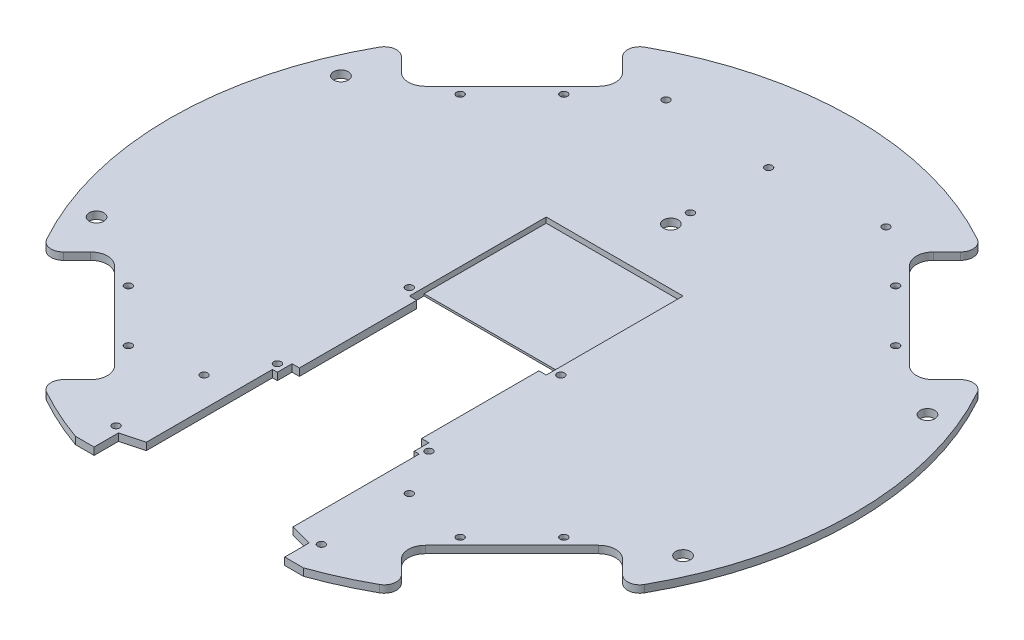
from build123d import *

# Parameters (mm, degrees)
SKETCH1_R                = 140
BOSS_EXTRUDE1_DEPTH      = 3
CUT_EXTRUDE4_REACH       = 200.013
CUT_EXTRUDE6_REACH       = 200.013
SKETCH9_R                = 1.5
FILLET1_R                = 5
CIRPATTERN1_COUNT        = 4
FILLET1_OF_CIRPATTERN1_R = 5
CUT_EXTRUDE1_REACH       = 200.013
FILLET3_R                = 1.5
CUT_EXTRUDE7_REACH       = 200.013
SKETCH10_R               = 1.5
CUT_EXTRUDE9_REACH       = 200.013
SKETCH13_R               = 1.5
CUT_EXTRUDE12_REACH      = 200.013
SKETCH16_R               = 1.5
SKETCH16_R_2             = 3
CUT_EXTRUDE13_REACH      = 200.013
SKETCH17_R               = 3
SKETCH18_W               = 56
SKETCH18_H               = 50
CUT_EXTRUDE14_DEPTH      = 2.2


with BuildPart() as part:
    # Sketch1 → Boss-Extrude1 (new body)
    with BuildSketch(Plane(origin=(0, 0, 0), x_dir=(1, 0, 0), z_dir=(0, 1, 0))):
        Circle(SKETCH1_R)
    extrude(amount=BOSS_EXTRUDE1_DEPTH)

    # Sketch7 → Cut-Extrude4 (cut, up to next)
    with BuildSketch(Plane(origin=(0, 3, 0), x_dir=(1, 0, 0), z_dir=(0, 1, 0)), mode=Mode.PRIVATE) as cut_extrude4_sk1:
        with BuildLine():
            Line((-99.030304705, -63.604254968), (-63.604254968, -99.030304705))
            ThreePointArc((-63.604254968, -99.030304705), (-61.568647097, -103.944696834), (-63.604254968, -108.859088964))
            Line((-63.604254968, -108.859088964), (-76.367532368, -121.622366364))
            Line((-76.367532368, -121.622366364), (-121.622366364, -76.367532368))
            Line((-121.622366364, -76.367532368), (-108.859088964, -63.604254968))
            ThreePointArc((-108.859088964, -63.604254968), (-103.944696834, -61.568647097), (-99.030304705, -63.604254968))
        make_face()
    cut_extrude4_tool1 = extrude(cut_extrude4_sk1.sketch, amount=-CUT_EXTRUDE4_REACH, mode=Mode.PRIVATE) & part.part
    cut_extrude4 = cut_extrude4_tool1.solids().sort_by_distance((-90.257735, 3, 90.257735))[0]
    add(cut_extrude4, mode=Mode.SUBTRACT)

    # Sketch9 → Cut-Extrude6 (cut, up to next)
    with BuildSketch(Plane(origin=(0, 3, 0), x_dir=(1, 0, 0), z_dir=(0, 1, 0)), mode=Mode.PRIVATE) as cut_extrude6_sk1:
        with Locations((-89.09545443, -67.882250994)):
            Circle(SKETCH9_R)
    cut_extrude6_tool1 = extrude(cut_extrude6_sk1.sketch, amount=-CUT_EXTRUDE6_REACH, mode=Mode.PRIVATE) & part.part
    # Sketch9 → Cut-Extrude6 (cut, up to next)
    with BuildSketch(Plane(origin=(0, 3, 0), x_dir=(1, 0, 0), z_dir=(0, 1, 0)), mode=Mode.PRIVATE) as cut_extrude6_sk2:
        with Locations((-67.882250994, -89.09545443)):
            Circle(SKETCH9_R)
    cut_extrude6_tool2 = extrude(cut_extrude6_sk2.sketch, amount=-CUT_EXTRUDE6_REACH, mode=Mode.PRIVATE) & part.part
    cut_extrude6_1 = cut_extrude6_tool1.solids().sort_by_distance((-89.095454, 3, 67.882251))[0]
    add(cut_extrude6_1, mode=Mode.SUBTRACT)
    cut_extrude6_2 = cut_extrude6_tool2.solids().sort_by_distance((-67.882251, 3, 89.095454))[0]
    add(cut_extrude6_2, mode=Mode.SUBTRACT)
    cut_extrude6 = cut_extrude6_1 + cut_extrude6_2  # Cut-Extrude6 as one shape, for the pattern or mirror that repeats it

    # Fillet1
    fillet1_edges = [part.edges().sort_by_distance(p)[0] for p in [
        (-73.746853427, 1.5, 119.001687423),
        (-119.001687423, 1.5, 73.746853427),
    ]]
    fillet(fillet1_edges, radius=FILLET1_R)

    # CirPattern1: Cut-Extrude4, Cut-Extrude6 ×4 about axis
    cirpattern1_axis = Axis((0, 3, 0), (0, 1, 0))
    add([cut_extrude4.rotate(cirpattern1_axis, i * 360 / CIRPATTERN1_COUNT) for i in range(1, CIRPATTERN1_COUNT)], mode=Mode.SUBTRACT)
    add([cut_extrude6.rotate(cirpattern1_axis, i * 360 / CIRPATTERN1_COUNT) for i in range(1, CIRPATTERN1_COUNT)], mode=Mode.SUBTRACT)

    # Fillet1 of CirPattern1
    fillet1_of_cirpattern1_edges = [part.edges().sort_by_distance(p)[0] for p in [
        (119.001687423, 1.5, 73.746853427),
        (73.746853427, 1.5, 119.001687423),
        (73.746853427, 1.5, -119.001687423),
        (119.001687423, 1.5, -73.746853427),
        (-119.001687423, 1.5, -73.746853427),
        (-73.746853427, 1.5, -119.001687423),
    ]]
    fillet(fillet1_of_cirpattern1_edges, radius=FILLET1_OF_CIRPATTERN1_R)

    # Sketch2 → Cut-Extrude1 (cut, up to next)
    with BuildSketch(Plane(origin=(0, 3, 0), x_dir=(1, 0, 0), z_dir=(0, 1, 0)), mode=Mode.PRIVATE) as cut_extrude1_sk1:
        Polygon((-46.647615159, -132), (-39, -132), (-39, -122), (-30, -119.588457268), (-30, -68), (-28, -68), (-28, -62), (-25, -62), (-25, -14), (-28, -14), (-28, -8), (28, -8), (28, -14), (25, -14), (25, -62), (28, -62), (28, -68), (30, -68), (30, -119.588457268), (39, -122), (39, -132), (46.647615159, -132), (46.647615159, -140), (-46.647615159, -140), align=None)
    cut_extrude1_tool1 = extrude(cut_extrude1_sk1.sketch, amount=-CUT_EXTRUDE1_REACH, mode=Mode.PRIVATE) & part.part
    add(cut_extrude1_tool1.solids().sort_by_distance((0, 3, 79.863408))[0], mode=Mode.SUBTRACT)

    # Fillet3
    fillet3_edges = [part.edges().sort_by_distance(p)[0] for p in [
        (67.882250994, 0, 90.59545443),
        (89.09545443, 0, 69.382250994),
        (90.59545443, 0, -67.882250994),
        (69.382250994, 0, -89.09545443),
        (-67.882250994, 0, -90.59545443),
        (-89.09545443, 0, -69.382250994),
        (-69.382250994, 0, 89.09545443),
        (-90.59545443, 0, 67.882250994),
    ]]
    fillet(fillet3_edges, radius=FILLET3_R)

    # Sketch10 → Cut-Extrude7 (cut, up to next)
    with BuildSketch(Plane(origin=(0, 3, 0), x_dir=(1, 0, 0), z_dir=(0, 1, 0)), mode=Mode.PRIVATE) as cut_extrude7_sk1:
        with Locations((-31, -65)):
            Circle(SKETCH10_R)
    cut_extrude7_tool1 = extrude(cut_extrude7_sk1.sketch, amount=-CUT_EXTRUDE7_REACH, mode=Mode.PRIVATE) & part.part
    # Sketch10 → Cut-Extrude7 (cut, up to next)
    with BuildSketch(Plane(origin=(0, 3, 0), x_dir=(1, 0, 0), z_dir=(0, 1, 0)), mode=Mode.PRIVATE) as cut_extrude7_sk2:
        with Locations((31, -65)):
            Circle(SKETCH10_R)
    cut_extrude7_tool2 = extrude(cut_extrude7_sk2.sketch, amount=-CUT_EXTRUDE7_REACH, mode=Mode.PRIVATE) & part.part
    # Sketch10 → Cut-Extrude7 (cut, up to next)
    with BuildSketch(Plane(origin=(0, 3, 0), x_dir=(1, 0, 0), z_dir=(0, 1, 0)), mode=Mode.PRIVATE) as cut_extrude7_sk3:
        with Locations((-31, -11)):
            Circle(SKETCH10_R)
    cut_extrude7_tool3 = extrude(cut_extrude7_sk3.sketch, amount=-CUT_EXTRUDE7_REACH, mode=Mode.PRIVATE) & part.part
    # Sketch10 → Cut-Extrude7 (cut, up to next)
    with BuildSketch(Plane(origin=(0, 3, 0), x_dir=(1, 0, 0), z_dir=(0, 1, 0)), mode=Mode.PRIVATE) as cut_extrude7_sk4:
        with Locations((31, -11)):
            Circle(SKETCH10_R)
    cut_extrude7_tool4 = extrude(cut_extrude7_sk4.sketch, amount=-CUT_EXTRUDE7_REACH, mode=Mode.PRIVATE) & part.part
    add(cut_extrude7_tool1.solids().sort_by_distance((-31, 3, 65))[0], mode=Mode.SUBTRACT)
    add(cut_extrude7_tool2.solids().sort_by_distance((31, 3, 65))[0], mode=Mode.SUBTRACT)
    add(cut_extrude7_tool3.solids().sort_by_distance((-31, 3, 11))[0], mode=Mode.SUBTRACT)
    add(cut_extrude7_tool4.solids().sort_by_distance((31, 3, 11))[0], mode=Mode.SUBTRACT)

    # Sketch13 → Cut-Extrude9 (cut, up to next)
    with BuildSketch(Plane(origin=(0, 3, 0), x_dir=(1, 0, 0), z_dir=(0, 1, 0)), mode=Mode.PRIVATE) as cut_extrude9_sk1:
        with Locations((-42, -84)):
            Circle(SKETCH13_R)
    cut_extrude9_tool1 = extrude(cut_extrude9_sk1.sketch, amount=-CUT_EXTRUDE9_REACH, mode=Mode.PRIVATE) & part.part
    # Sketch13 → Cut-Extrude9 (cut, up to next)
    with BuildSketch(Plane(origin=(0, 3, 0), x_dir=(1, 0, 0), z_dir=(0, 1, 0)), mode=Mode.PRIVATE) as cut_extrude9_sk2:
        with Locations((-42, -120)):
            Circle(SKETCH13_R)
    cut_extrude9_tool2 = extrude(cut_extrude9_sk2.sketch, amount=-CUT_EXTRUDE9_REACH, mode=Mode.PRIVATE) & part.part
    # Sketch13 → Cut-Extrude9 (cut, up to next)
    with BuildSketch(Plane(origin=(0, 3, 0), x_dir=(1, 0, 0), z_dir=(0, 1, 0)), mode=Mode.PRIVATE) as cut_extrude9_sk3:
        with Locations((42, -120)):
            Circle(SKETCH13_R)
    cut_extrude9_tool3 = extrude(cut_extrude9_sk3.sketch, amount=-CUT_EXTRUDE9_REACH, mode=Mode.PRIVATE) & part.part
    # Sketch13 → Cut-Extrude9 (cut, up to next)
    with BuildSketch(Plane(origin=(0, 3, 0), x_dir=(1, 0, 0), z_dir=(0, 1, 0)), mode=Mode.PRIVATE) as cut_extrude9_sk4:
        with Locations((42, -84)):
            Circle(SKETCH13_R)
    cut_extrude9_tool4 = extrude(cut_extrude9_sk4.sketch, amount=-CUT_EXTRUDE9_REACH, mode=Mode.PRIVATE) & part.part
    add(cut_extrude9_tool1.solids().sort_by_distance((-42, 3, 84))[0], mode=Mode.SUBTRACT)
    add(cut_extrude9_tool2.solids().sort_by_distance((-42, 3, 120))[0], mode=Mode.SUBTRACT)
    add(cut_extrude9_tool3.solids().sort_by_distance((42, 3, 120))[0], mode=Mode.SUBTRACT)
    add(cut_extrude9_tool4.solids().sort_by_distance((42, 3, 84))[0], mode=Mode.SUBTRACT)

    # Sketch16 → Cut-Extrude12 (cut, up to next)
    with BuildSketch(Plane(origin=(0, 3, 0), x_dir=(1, 0, 0), z_dir=(0, 1, 0)), mode=Mode.PRIVATE) as cut_extrude12_sk1:
        with Locations((0, 73)):
            Circle(SKETCH16_R)
    cut_extrude12_tool1 = extrude(cut_extrude12_sk1.sketch, amount=-CUT_EXTRUDE12_REACH, mode=Mode.PRIVATE) & part.part
    # Sketch16 → Cut-Extrude12 (cut, up to next)
    with BuildSketch(Plane(origin=(0, 3, 0), x_dir=(1, 0, 0), z_dir=(0, 1, 0)), mode=Mode.PRIVATE) as cut_extrude12_sk2:
        with Locations((-45, 108)):
            Circle(SKETCH16_R)
    cut_extrude12_tool2 = extrude(cut_extrude12_sk2.sketch, amount=-CUT_EXTRUDE12_REACH, mode=Mode.PRIVATE) & part.part
    # Sketch16 → Cut-Extrude12 (cut, up to next)
    with BuildSketch(Plane(origin=(0, 3, 0), x_dir=(1, 0, 0), z_dir=(0, 1, 0)), mode=Mode.PRIVATE) as cut_extrude12_sk3:
        with Locations((45, 108)):
            Circle(SKETCH16_R)
    cut_extrude12_tool3 = extrude(cut_extrude12_sk3.sketch, amount=-CUT_EXTRUDE12_REACH, mode=Mode.PRIVATE) & part.part
    # Sketch16 → Cut-Extrude12 (cut, up to next)
    with BuildSketch(Plane(origin=(0, 3, 0), x_dir=(1, 0, 0), z_dir=(0, 1, 0)), mode=Mode.PRIVATE) as cut_extrude12_sk4:
        with Locations((0, 105)):
            Circle(SKETCH16_R)
    cut_extrude12_tool4 = extrude(cut_extrude12_sk4.sketch, amount=-CUT_EXTRUDE12_REACH, mode=Mode.PRIVATE) & part.part
    # Sketch16 → Cut-Extrude12 (cut, up to next)
    with BuildSketch(Plane(origin=(0, 3, 0), x_dir=(1, 0, 0), z_dir=(0, 1, 0)), mode=Mode.PRIVATE) as cut_extrude12_sk5:
        with Locations((0, 65)):
            Circle(SKETCH16_R_2)
    cut_extrude12_tool5 = extrude(cut_extrude12_sk5.sketch, amount=-CUT_EXTRUDE12_REACH, mode=Mode.PRIVATE) & part.part
    add(cut_extrude12_tool1.solids().sort_by_distance((0, 3, -73))[0], mode=Mode.SUBTRACT)
    add(cut_extrude12_tool2.solids().sort_by_distance((-45, 3, -108))[0], mode=Mode.SUBTRACT)
    add(cut_extrude12_tool3.solids().sort_by_distance((45, 3, -108))[0], mode=Mode.SUBTRACT)
    add(cut_extrude12_tool4.solids().sort_by_distance((0, 3, -105))[0], mode=Mode.SUBTRACT)
    add(cut_extrude12_tool5.solids().sort_by_distance((0, 3, -65))[0], mode=Mode.SUBTRACT)

    # Sketch17 → Cut-Extrude13 (cut, up to next)
    with BuildSketch(Plane(origin=(0, 3, 0), x_dir=(1, 0, 0), z_dir=(0, 1, 0)), mode=Mode.PRIVATE) as cut_extrude13_sk1:
        with Locations((-120, 50)):
            Circle(SKETCH17_R)
    cut_extrude13_tool1 = extrude(cut_extrude13_sk1.sketch, amount=-CUT_EXTRUDE13_REACH, mode=Mode.PRIVATE) & part.part
    # Sketch17 → Cut-Extrude13 (cut, up to next)
    with BuildSketch(Plane(origin=(0, 3, 0), x_dir=(1, 0, 0), z_dir=(0, 1, 0)), mode=Mode.PRIVATE) as cut_extrude13_sk2:
        with Locations((-120, -50)):
            Circle(SKETCH17_R)
    cut_extrude13_tool2 = extrude(cut_extrude13_sk2.sketch, amount=-CUT_EXTRUDE13_REACH, mode=Mode.PRIVATE) & part.part
    # Sketch17 → Cut-Extrude13 (cut, up to next)
    with BuildSketch(Plane(origin=(0, 3, 0), x_dir=(1, 0, 0), z_dir=(0, 1, 0)), mode=Mode.PRIVATE) as cut_extrude13_sk3:
        with Locations((120, 50)):
            Circle(SKETCH17_R)
    cut_extrude13_tool3 = extrude(cut_extrude13_sk3.sketch, amount=-CUT_EXTRUDE13_REACH, mode=Mode.PRIVATE) & part.part
    # Sketch17 → Cut-Extrude13 (cut, up to next)
    with BuildSketch(Plane(origin=(0, 3, 0), x_dir=(1, 0, 0), z_dir=(0, 1, 0)), mode=Mode.PRIVATE) as cut_extrude13_sk4:
        with Locations((120, -50)):
            Circle(SKETCH17_R)
    cut_extrude13_tool4 = extrude(cut_extrude13_sk4.sketch, amount=-CUT_EXTRUDE13_REACH, mode=Mode.PRIVATE) & part.part
    add(cut_extrude13_tool1.solids().sort_by_distance((-120, 3, -50))[0], mode=Mode.SUBTRACT)
    add(cut_extrude13_tool2.solids().sort_by_distance((-120, 3, 50))[0], mode=Mode.SUBTRACT)
    add(cut_extrude13_tool3.solids().sort_by_distance((120, 3, -50))[0], mode=Mode.SUBTRACT)
    add(cut_extrude13_tool4.solids().sort_by_distance((120, 3, 50))[0], mode=Mode.SUBTRACT)

    # Sketch18 → Cut-Extrude14 (cut)
    with BuildSketch(Plane(origin=(0, 3, 0), x_dir=(1, 0, 0), z_dir=(0, 1, 0))):
        with Locations((0, 17)):
            Rectangle(SKETCH18_W, SKETCH18_H)
    extrude(amount=-CUT_EXTRUDE14_DEPTH, mode=Mode.SUBTRACT)


solid = part.part
